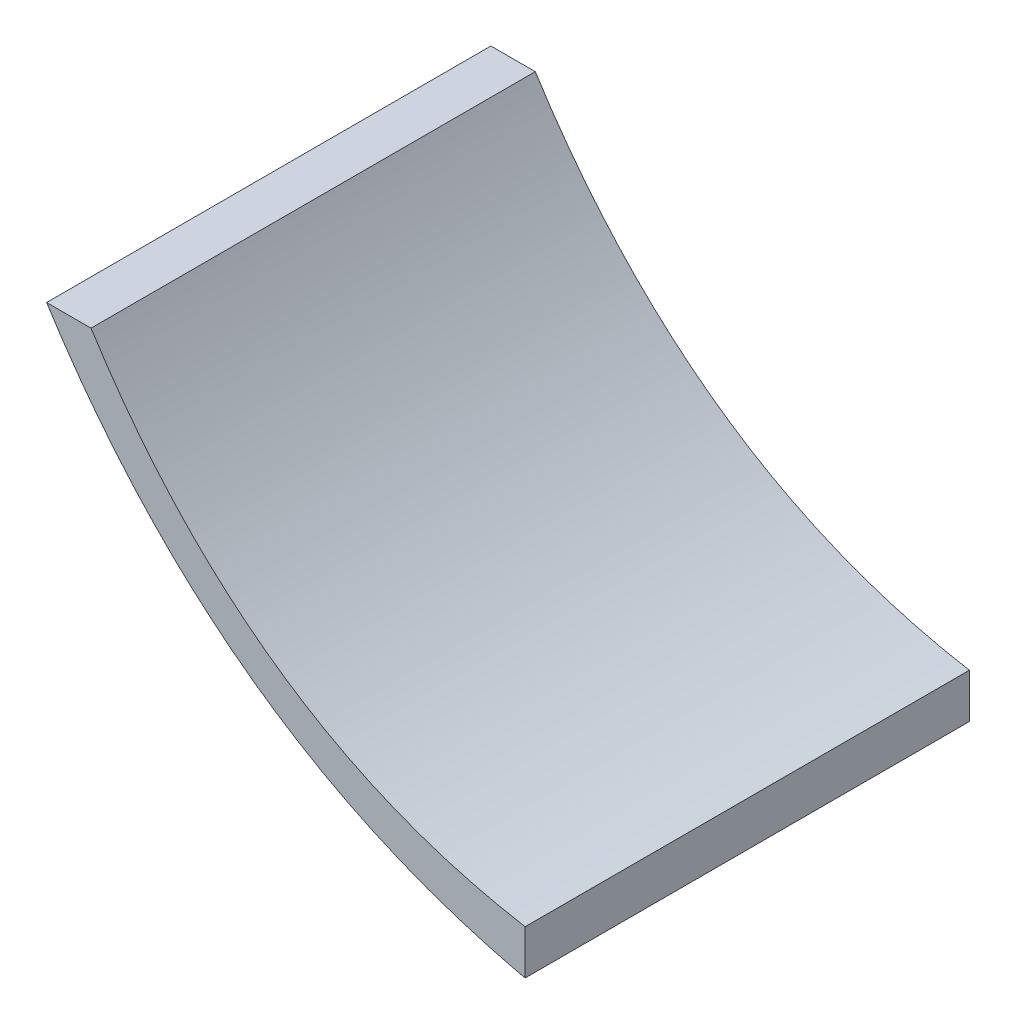
from build123d import *

# Parameters (mm, degrees)
BOSS_EXTRUDE1_DEPTH = 63.5


with BuildPart() as part:
    # Sketch1 → Boss-Extrude1 (new, symmetric)
    with BuildSketch(Plane.XY):
        with BuildLine():
            Line((-124.10088452, 83.444670904), (-136.80088452, 83.444670904))
            add(Edge.make_bspline(
                [(-136.80088452, 83.444670904), (-86.491178368, 4.115360934), (0, -15.381825942)],
                knots=[0, 0, 0, 1, 1, 1], degree=2))
            Line((0, -15.381825942), (0, -2.681825942))
            add(Edge.make_bspline(
                [(-124.10088452, 83.444670904), (-77.99249087, 10.661164743), (0, -2.681825942)],
                knots=[0, 0, 0, 1, 1, 1], degree=2))
        make_face()
    extrude(amount=BOSS_EXTRUDE1_DEPTH, both=True)


solid = part.part
